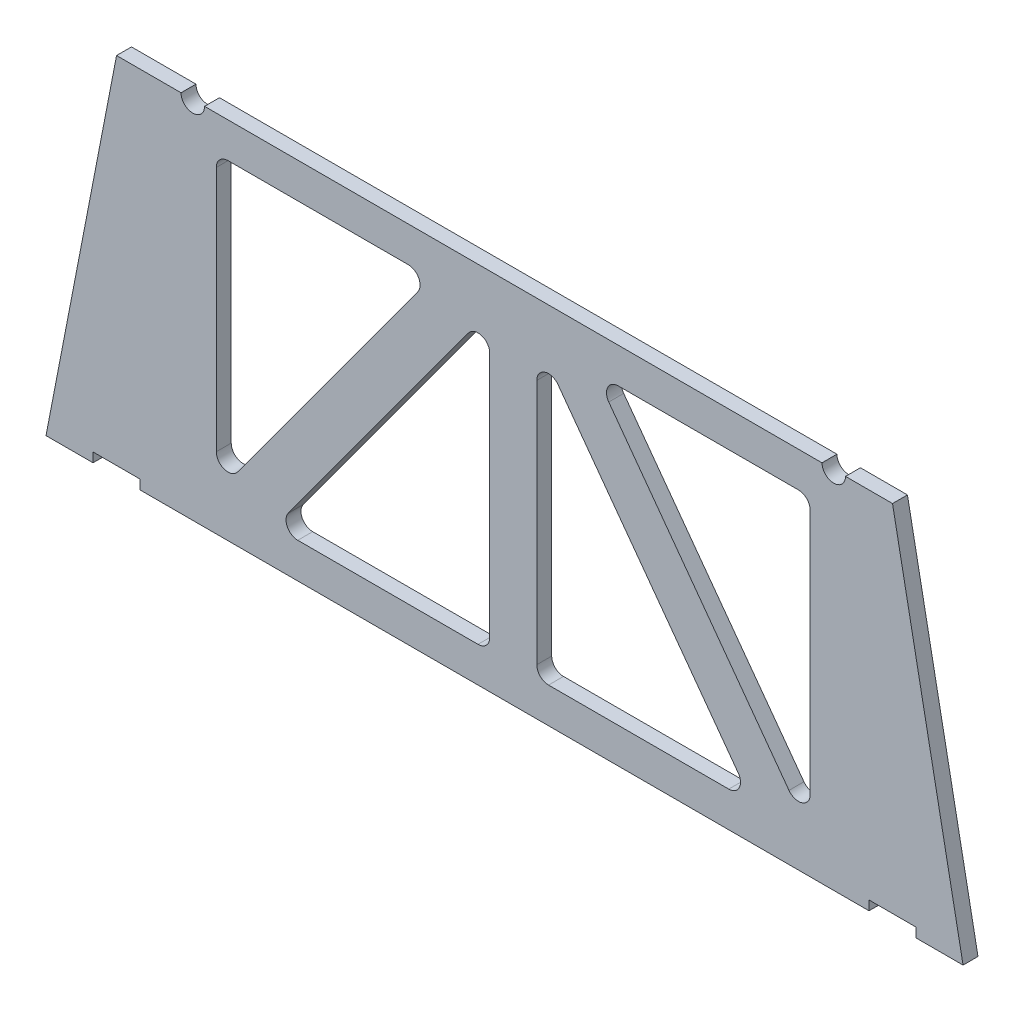
from build123d import *

# Parameters (mm, degrees)
EXTRUDE1_DEPTH = 6.35


with BuildPart() as part:
    # Sketch1 → Extrude1 (new body)
    with BuildSketch(Plane.XY):
        with BuildLine():
            Line((-158.7125, -73.5), (-158.7125, -77.5))
            Line((-158.7125, -77.5), (151.2875, -77.5))
            Line((151.2875, -77.5), (151.2875, -73.5))
            Line((151.2875, -73.5), (171.2875, -73.5))
            Line((171.2875, -73.5), (171.2875, -77.5))
            Line((171.2875, -77.5), (191.2875, -77.5))
            Line((191.2875, -77.5), (161.2875, 77.5))
            Line((161.2875, 77.5), (141.2875, 77.5))
            ThreePointArc((141.2875, 77.5), (136.2875, 72.5), (131.2875, 77.5))
            Line((131.2875, 77.5), (-131.2875, 77.5))
            ThreePointArc((-131.2875, 77.5), (-136.2875, 72.5), (-141.2875, 77.5))
            Line((-141.2875, 77.5), (-168.7125, 77.5))
            Line((-168.7125, 77.5), (-198.7125, -77.5))
            Line((-198.7125, -77.5), (-178.7125, -77.5))
            Line((-178.7125, -77.5), (-178.7125, -73.5))
            Line((-178.7125, -73.5), (-158.7125, -73.5))
        make_face()
        with BuildLine():
            ThreePointArc((-91.645144476, -62.5), (-96.104223439, -59.761993545), (-95.679707608, -54.546645918))
            Line((-95.679707608, -54.546645918), (-19.034563132, 50.157925762))
            ThreePointArc((-19.034563132, 50.157925762), (-13.446426001, 51.957087628), (-10, 47.204571681))
            Line((-10, 47.204571681), (-10, -57.5))
            ThreePointArc((-10, -57.5), (-11.464466094, -61.035533906), (-15, -62.5))
            Line((-15, -62.5), (-91.645144476, -62.5))
        make_face(mode=Mode.SUBTRACT)
        with BuildLine():
            Line((-126.2875, -47.204571681), (-126.2875, 57.5))
            ThreePointArc((-126.2875, 57.5), (-124.823033906, 61.035533906), (-121.2875, 62.5))
            Line((-121.2875, 62.5), (-44.642355524, 62.5))
            ThreePointArc((-44.642355524, 62.5), (-40.183276561, 59.761993545), (-40.607792392, 54.546645918))
            Line((-40.607792392, 54.546645918), (-117.252936868, -50.157925762))
            ThreePointArc((-117.252936868, -50.157925762), (-122.841073999, -51.957087628), (-126.2875, -47.204571681))
        make_face(mode=Mode.SUBTRACT)
        with BuildLine():
            Line((44.642355524, 62.5), (121.2875, 62.5))
            ThreePointArc((121.2875, 62.5), (124.823033906, 61.035533906), (126.2875, 57.5))
            Line((126.2875, 57.5), (126.2875, -47.204571681))
            ThreePointArc((126.2875, -47.204571681), (122.841073999, -51.957087628), (117.252936868, -50.157925762))
            Line((117.252936868, -50.157925762), (40.607792392, 54.546645918))
            ThreePointArc((40.607792392, 54.546645918), (40.183276561, 59.761993545), (44.642355524, 62.5))
        make_face(mode=Mode.SUBTRACT)
        with BuildLine():
            Line((91.645144476, -62.5), (15, -62.5))
            ThreePointArc((15, -62.5), (11.464466094, -61.035533906), (10, -57.5))
            Line((10, -57.5), (10, 47.204571681))
            ThreePointArc((10, 47.204571681), (13.446426001, 51.957087628), (19.034563132, 50.157925762))
            Line((19.034563132, 50.157925762), (95.679707608, -54.546645918))
            ThreePointArc((95.679707608, -54.546645918), (96.104223439, -59.761993545), (91.645144476, -62.5))
        make_face(mode=Mode.SUBTRACT)
    extrude(amount=EXTRUDE1_DEPTH)


solid = part.part
